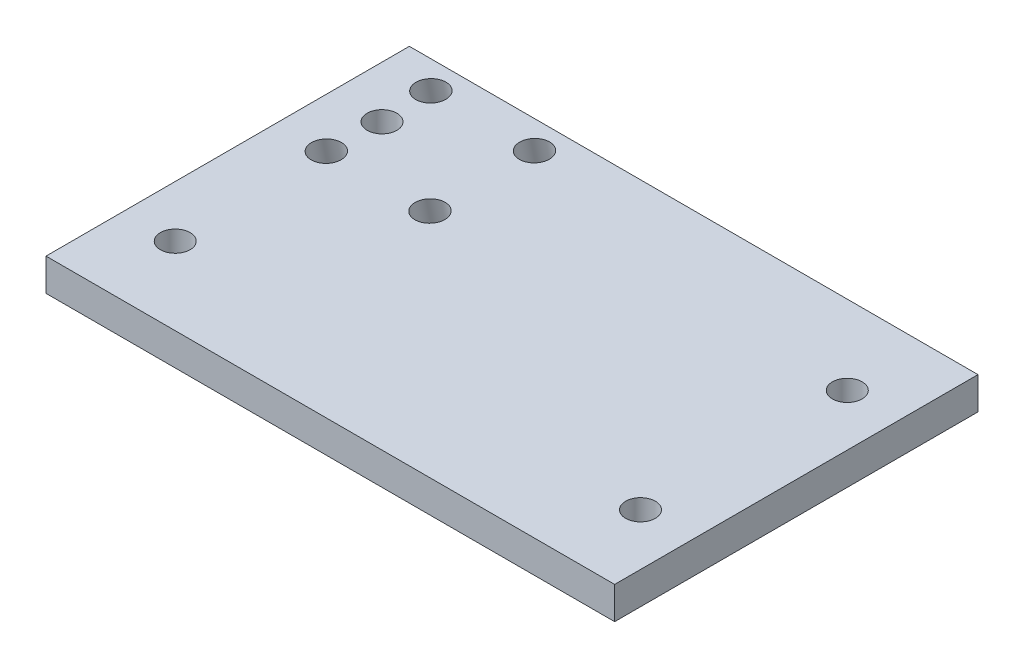
from build123d import *

# Parameters (mm, degrees)
SKETCH1_W           = 90
SKETCH1_H           = 56.23
BOSS_EXTRUDE1_DEPTH = 5
SKETCH2_R           = 2.3
CUT_EXTRUDE1_DEPTH  = 15
SKETCH7_R           = 2.3
CUT_EXTRUDE3_DEPTH  = 45
SKETCH9_W           = 61.183864123
SKETCH9_H           = 5.04390519
CUT_EXTRUDE4_DEPTH  = 2
SKETCH11_R          = 2.3
CUT_EXTRUDE5_DEPTH  = 50


with BuildPart() as part:
    # Sketch1 → Boss-Extrude1 (new body)
    with BuildSketch(Plane(origin=(0, 0, 0), x_dir=(1, 0, 0), z_dir=(0, 1, 0))):
        with Locations((45, 28.115)):
            Rectangle(SKETCH1_W, SKETCH1_H)
    extrude(amount=BOSS_EXTRUDE1_DEPTH)

    # Sketch2 → Cut-Extrude1 (cut)
    with BuildSketch(Plane(origin=(0, 5, 0), x_dir=(1, 0, 0), z_dir=(0, 1, 0))):
        with Locations((82, 12)):
            Circle(SKETCH2_R)
        with Locations((10, 12)):
            Circle(SKETCH2_R)
    extrude(amount=-CUT_EXTRUDE1_DEPTH, mode=Mode.SUBTRACT)

    # Sketch7 → Cut-Extrude3 (cut)
    with BuildSketch(Plane(origin=(0, 5, 0), x_dir=(1, 0, 0), z_dir=(0, 1, 0))):
        with Locations((82, 44)):
            Circle(SKETCH7_R)
        with Locations((10, 44)):
            Circle(SKETCH7_R)
    extrude(amount=-CUT_EXTRUDE3_DEPTH, mode=Mode.SUBTRACT)

    # Sketch9 → Cut-Extrude4 (cut)
    with BuildSketch(Plane.ZY):
        with Locations((-25.638067939, 2.521952595)):
            Rectangle(SKETCH9_W, SKETCH9_H)
    extrude(amount=-CUT_EXTRUDE4_DEPTH, mode=Mode.SUBTRACT)

    # Sketch11 → Cut-Extrude5 (cut)
    with BuildSketch(Plane(origin=(0, 4.817959636, 0.936516484), x_dir=(1, 0, 0), z_dir=(0, 0.9816271834476639, 0.19080899537654525))):
        with Locations((9.633166576, 51.926922952)):
            Circle(SKETCH11_R)
        with Locations((25.670969415, 51.926922952)):
            Circle(SKETCH11_R)
        with Locations((9.633166576, 36.04624923)):
            Circle(SKETCH11_R)
        with Locations((25.670969415, 36.04624923)):
            Circle(SKETCH11_R)
    extrude(amount=-CUT_EXTRUDE5_DEPTH, mode=Mode.SUBTRACT)


solid = part.part
